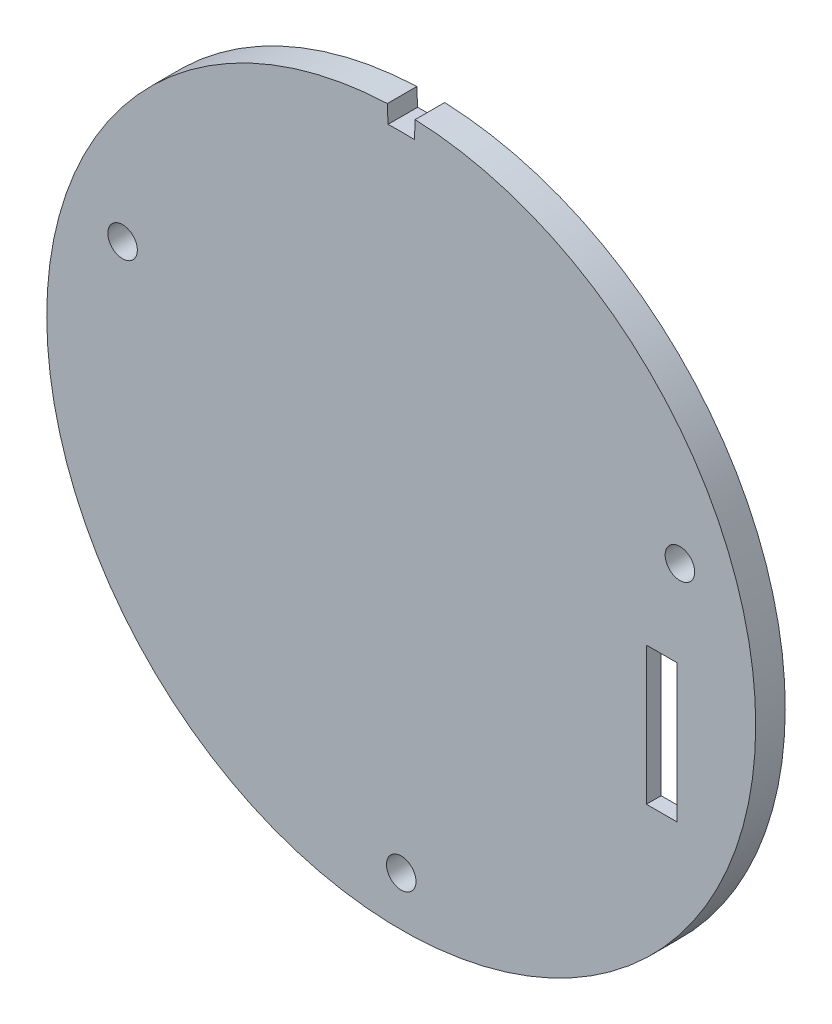
from build123d import *

# Parameters (mm, degrees)
SKETCH1_R           = 1.5
BOSS_EXTRUDE3_DEPTH = 3
BOSS_EXTRUDE4_DEPTH = 1.5


with BuildPart() as part:
    # Sketch1 → Boss-Extrude3 (new body)
    with BuildSketch(Plane.XY):
        with BuildLine():
            Line((-1.342685699, 34.173633039), (-1.413353367, 35.972245305))
            ThreePointArc((-1.413353367, 35.972245305), (0, -36), (1.413353367, 35.972245305))
            Line((1.413353367, 35.972245305), (1.342685699, 34.173633039))
            ThreePointArc((1.342685699, 34.173633039), (0, 34.2), (-1.342685699, 34.173633039))
        make_face()
        with Locations((0, -31)):
            Circle(SKETCH1_R, mode=Mode.SUBTRACT)
        Polygon((-28, -17), (-28, 4.5), (28, 4.5), (28, 1.5), (28, -12.5), (28, -17), (21.5, -23.5), (-21.5, -23.5), align=None, mode=Mode.SUBTRACT)
        with Locations((-28.3, 10.376069152)):
            Circle(SKETCH1_R, mode=Mode.SUBTRACT)
        with Locations((28.3, 10.376069152)):
            Circle(SKETCH1_R, mode=Mode.SUBTRACT)
    extrude(amount=-BOSS_EXTRUDE3_DEPTH)

    # Sketch1<9> → Boss-Extrude4 (add)
    with BuildSketch(Plane.XY):
        Polygon((28, 4.5), (-28, 4.5), (-28, -17), (-21.5, -23.5), (21.5, -23.5), (28, -17), (28, -12.5), (24.9, -12.5), (24.9, 1.5), (28, 1.5), align=None)
    extrude(amount=-BOSS_EXTRUDE4_DEPTH)


solid = part.part
